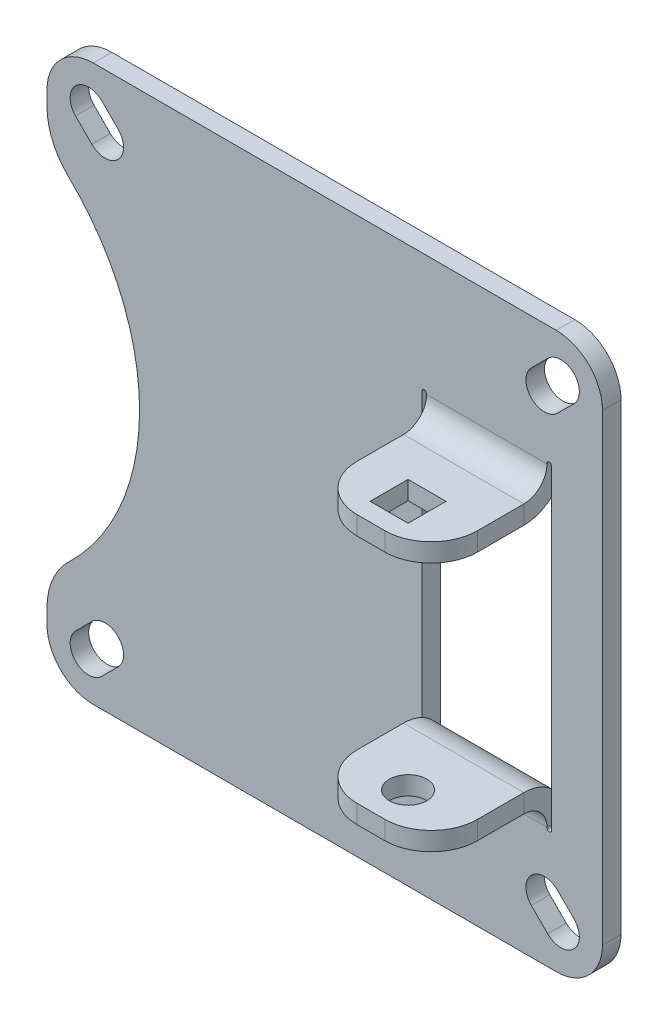
from build123d import *

# Parameters (mm, degrees)
SKETCH_1_W           = 120
SKETCH_1_H           = 120
SKETCH_1_W_2         = 28
SKETCH_1_H_2         = 50
BASE_PLATE_DEPTH     = 4
TABS2_START          = -5
TABS2_DEPTH          = 10
TABS2_2_OUTLINE_W    = 26
TABS2_2_OUTLINE_H    = 4
TABS2_2_DEPTH        = 1.41096
TABS2_START_2        = 5
TABS2_3_OUTLINE_W    = 26
TABS2_3_OUTLINE_H    = 4
TABS2_3_DEPTH        = 20
TABS2_START_3        = -13
TABS2_4_DEPTH        = 26
TABS2_5_DEPTH        = 26
HOLE1_DEPTH          = 116.108644332
HOLE1_DEPTH_BACK     = 116.108644332
SKETCH_10_R          = 4.05
SKETCH_12_W          = 8.2
SKETCH_12_H          = 8.2
HOLE2_DEPTH          = 4
FILLETS_R            = 10
SKETCH_11_R          = 4
OBLONG_HOLES_DEPTH   = 4
OBLONG_HOLES_2_DEPTH = 4
FILLETS2_DEPTH       = 4
FILLETS3_R           = 15


with BuildPart() as part:
    # Base Plate: sheet metal written as solids
    # Sketch 1 → Base Plate (new body)
    with BuildSketch(Plane.XY):
        with Locations((-35, 0)):
            Rectangle(SKETCH_1_W, SKETCH_1_H)
        Rectangle(SKETCH_1_W_2, SKETCH_1_H_2, mode=Mode.SUBTRACT)
    extrude(amount=-BASE_PLATE_DEPTH)

    # Tabs2: read off the stored shape, not the designer's step
    # Tabs2 outline → Tabs2 (cut)
    with BuildSketch(Plane.XY.offset(TABS2_START)):
        with BuildLine():
            ThreePointArc((-13, 34.1), (-13.5, 34.6), (-14, 34.1))
            Line((-14, 34.1), (-14, 25))
            Line((-14, 25), (-13, 25))
            Line((-13, 25), (-13, 34.1))
        make_face()
        with BuildLine():
            Line((-13, -25), (-14, -25))
            Line((-14, -25), (-14, -34.1))
            ThreePointArc((-14, -34.1), (-13.5, -34.6), (-13, -34.1))
            Line((-13, -34.1), (-13, -25))
        make_face()
        with BuildLine():
            Line((13, 34.1), (13, 25))
            Line((13, 25), (14, 25))
            Line((14, 25), (14, 34.1))
            ThreePointArc((14, 34.1), (13.5, 34.6), (13, 34.1))
        make_face()
        with BuildLine():
            Line((14, -25), (13, -25))
            Line((13, -25), (13, -34.1))
            ThreePointArc((13, -34.1), (13.5, -34.6), (14, -34.1))
            Line((14, -34.1), (14, -25))
        make_face()
    extrude(amount=TABS2_DEPTH, mode=Mode.SUBTRACT)

    # Tabs2 2 outline → Tabs2 2 (cut)
    with BuildSketch(Plane.XY.offset(TABS2_START)):
        with Locations((0, 27)):
            Rectangle(TABS2_2_OUTLINE_W, TABS2_2_OUTLINE_H)
        with Locations((0, -27)):
            Rectangle(TABS2_2_OUTLINE_W, TABS2_2_OUTLINE_H)
    extrude(amount=TABS2_2_DEPTH, mode=Mode.SUBTRACT)

    # Tabs2 4 outline → Tabs2 4 (cut)
    with BuildSketch(Plane.YZ.offset(TABS2_START_3)):
        with BuildLine():
            ThreePointArc((34, -4), (29.757359313, -2.937253933), (26.516685226, 0))
            Line((26.516685226, 0), (25, 0))
            Line((25, 0), (25, -3.58904))
            Line((25, -3.58904), (29, -3.58904))
            Line((29, -3.58904), (29, -4))
            Line((29, -4), (34, -4))
        make_face()
        with BuildLine():
            Line((-25, -3.58904), (-25, 0))
            Line((-25, 0), (-26.516685226, 0))
            ThreePointArc((-26.516685226, 0), (-29.757359313, -2.937253933), (-34, -4))
            Line((-34, -4), (-29, -4))
            Line((-29, -4), (-29, -3.58904))
            Line((-29, -3.58904), (-25, -3.58904))
        make_face()
    extrude(amount=TABS2_4_DEPTH, mode=Mode.SUBTRACT)



with BuildPart() as body_2:
    # Tabs2 3 outline → Tabs2 3 (new body)
    with BuildSketch(Plane.XY.offset(TABS2_START_2)):
        with Locations((0, 27)):
            Rectangle(TABS2_3_OUTLINE_W, TABS2_3_OUTLINE_H)
        with Locations((0, -27)):
            Rectangle(TABS2_3_OUTLINE_W, TABS2_3_OUTLINE_H)
    extrude(amount=TABS2_3_DEPTH)


with BuildPart() as part_1:
    add(part.part)

    add(body_2.part)  # Tabs2 5 merges body 2
    # Tabs2 5 outline → Tabs2 5 (add)
    with BuildSketch(Plane.YZ.offset(TABS2_START_3)):
        with BuildLine():
            Line((29, 5), (25, 5))
            ThreePointArc((25, 5), (25.38751392, 2.38751392), (26.516685226, 0))
            Line((26.516685226, 0), (34, 0))
            ThreePointArc((34, 0), (30.464466094, 1.464466094), (29, 5))
        make_face()
        with BuildLine():
            Line((-34, 0), (-26.516685226, 0))
            ThreePointArc((-26.516685226, 0), (-25.38751392, 2.38751392), (-25, 5))
            Line((-25, 5), (-29, 5))
            ThreePointArc((-29, 5), (-30.464466094, 1.464466094), (-34, 0))
        make_face()
    extrude(amount=TABS2_5_DEPTH)

    # Эскиз10 → Hole1 (cut, two sides: drawn at the far end of the back side and taken through both)
    with BuildSketch(Plane(origin=(0, 0, 0), x_dir=(1, 0, 0), z_dir=(0, 1, 0)).offset(-HOLE1_DEPTH_BACK)):
        with Locations(Location((0, -17, 0), (0, 0, 90))):
            Circle(SKETCH_10_R)
    extrude(amount=HOLE1_DEPTH + HOLE1_DEPTH_BACK, mode=Mode.SUBTRACT)

    # Эскиз12 → Hole2 (cut)
    with BuildSketch(Plane(origin=(0, 29, 0), x_dir=(1, 0, 0), z_dir=(0, 1, 0))):
        with Locations((0, -17)):
            Rectangle(SKETCH_12_W, SKETCH_12_H)
    extrude(amount=-HOLE2_DEPTH, mode=Mode.SUBTRACT)

    # Fillets
    fillets_edges = [part_1.edges().sort_by_distance(p)[0] for p in [
        (13, -27, 25),
        (-13, -27, 25),
        (-95, 60, -2),
        (25, 60, -2),
        (25, -60, -2),
        (-95, -60, -2),
        (-13, 27, 25),
        (13, 27, 25),
    ]]
    fillet(fillets_edges, radius=FILLETS_R)

    # Эскиз11 → Oblong Holes (cut)
    with BuildSketch(Plane.XY):
        with Locations((-86, 51)):
            Circle(SKETCH_11_R)
        with Locations((16, 51)):
            Circle(SKETCH_11_R)
        with Locations((-86, -51)):
            Circle(SKETCH_11_R)
        with Locations((16, -51)):
            Circle(SKETCH_11_R)
    extrude(amount=-OBLONG_HOLES_DEPTH, mode=Mode.SUBTRACT)

    # Эскиз13 → oblong Holes 2 (cut)
    with BuildSketch(Plane.XY):
        with BuildLine():
            Line((-83.171572875, 53.828427125), (-79.636038969, 50.292893219))
            ThreePointArc((-79.636038969, 50.292893219), (-79.636038969, 44.636038969), (-85.292893219, 44.636038969))
            Line((-85.292893219, 44.636038969), (-88.828427125, 48.171572875))
            ThreePointArc((-88.828427125, 48.171572875), (-88.828427125, 53.828427125), (-83.171572875, 53.828427125))
        make_face()
        with BuildLine():
            Line((18.828427125, 48.171572875), (15.292893219, 44.636038969))
            ThreePointArc((15.292893219, 44.636038969), (9.636038969, 44.636038969), (9.636038969, 50.292893219))
            Line((9.636038969, 50.292893219), (13.171572875, 53.828427125))
            ThreePointArc((13.171572875, 53.828427125), (18.828427125, 53.828427125), (18.828427125, 48.171572875))
        make_face()
        with BuildLine():
            Line((-88.828427125, -48.171572875), (-85.292893219, -44.636038969))
            ThreePointArc((-85.292893219, -44.636038969), (-79.636038969, -44.636038969), (-79.636038969, -50.292893219))
            Line((-79.636038969, -50.292893219), (-83.171572875, -53.828427125))
            ThreePointArc((-83.171572875, -53.828427125), (-88.828427125, -53.828427125), (-88.828427125, -48.171572875))
        make_face()
        with BuildLine():
            Line((13.171572875, -53.828427125), (9.636038969, -50.292893219))
            ThreePointArc((9.636038969, -50.292893219), (9.636038969, -44.636038969), (15.292893219, -44.636038969))
            Line((15.292893219, -44.636038969), (18.828427125, -48.171572875))
            ThreePointArc((18.828427125, -48.171572875), (18.828427125, -53.828427125), (13.171572875, -53.828427125))
        make_face()
    extrude(amount=-OBLONG_HOLES_2_DEPTH, mode=Mode.SUBTRACT)

    # Эскиз14 → Fillets2 (cut)
    with BuildSketch(Plane.XY):
        with BuildLine():
            Line((-95, 40), (-95, -40))
            ThreePointArc((-95, -40), (-75, 0), (-95, 40))
        make_face()
    extrude(amount=-FILLETS2_DEPTH, mode=Mode.SUBTRACT)

    # Fillets3
    fillets3_edges = [part_1.edges().sort_by_distance(p)[0] for p in [
        (-95, 40, -2),
        (-95, -40, -2),
    ]]
    fillet(fillets3_edges, radius=FILLETS3_R)


solid = part_1.part
